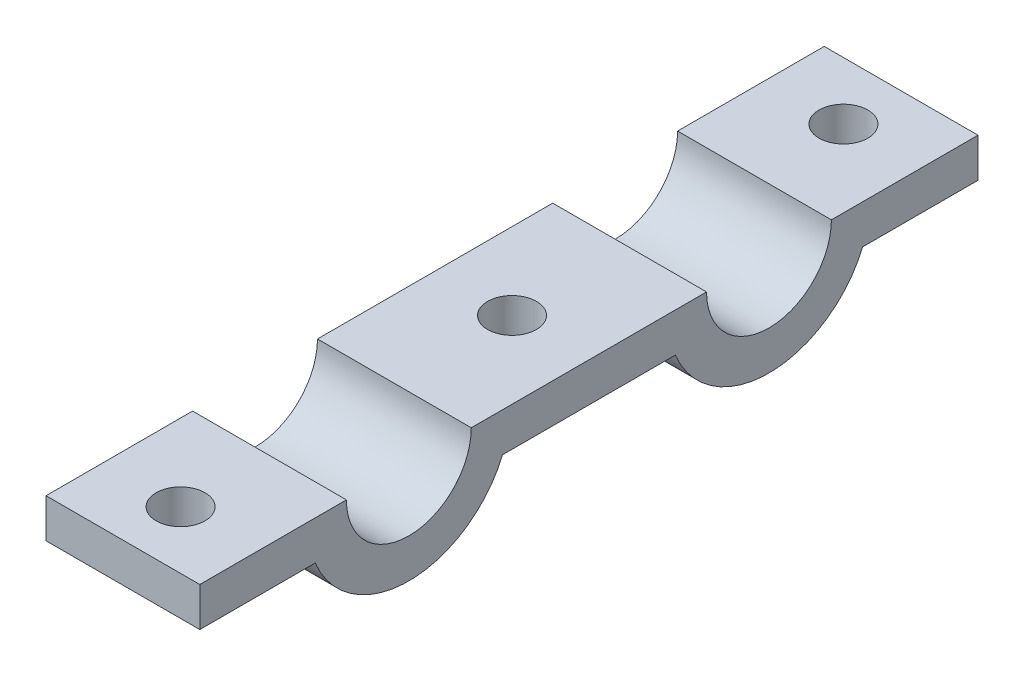
from build123d import *

# Parameters (mm, degrees)
BOSS_EXTRUDE1_DEPTH = 40
CUT_EXTRUDE1_REACH  = 157.594
SKETCH3_R           = 6.35


with BuildPart() as part:
    # Sketch2 → Boss-Extrude1 (new body)
    with BuildSketch(Plane(origin=(0, 0, 0), x_dir=(0, 0, -1), z_dir=(1, 0, 0))):
        with BuildLine():
            Line((-16.24, 0), (-54.366665755, 0))
            Line((-54.366665755, 0), (-54.366665755, -10.16))
            Line((-54.366665755, -10.16), (-24.366665755, -10.16))
            ThreePointArc((-24.366665755, -10.16), (0, -26.4), (24.366665755, -10.16))
            Line((24.366665755, -10.16), (69.295834245, -10.16))
            ThreePointArc((69.295834245, -10.16), (93.6625, -26.4), (118.029165755, -10.16))
            Line((118.029165755, -10.16), (148.029165755, -10.16))
            Line((148.029165755, -10.16), (148.029165755, 0))
            Line((148.029165755, 0), (109.9025, 0))
            ThreePointArc((109.9025, 0), (93.6625, -16.24), (77.4225, 0))
            Line((77.4225, 0), (16.24, 0))
            ThreePointArc((16.24, 0), (0, -16.24), (-16.24, 0))
        make_face()
    extrude(amount=BOSS_EXTRUDE1_DEPTH)

    # Sketch3 → Cut-Extrude1 (cut, up to next)
    with BuildSketch(Plane(origin=(0, 0, 0), x_dir=(1, 0, 0), z_dir=(0, 1, 0)), mode=Mode.PRIVATE) as cut_extrude1_sk1:
        with Locations((20, -39.366665755)):
            Circle(SKETCH3_R)
    cut_extrude1_tool1 = extrude(cut_extrude1_sk1.sketch, amount=-CUT_EXTRUDE1_REACH, mode=Mode.PRIVATE) & part.part
    # Sketch3 → Cut-Extrude1 (cut, up to next)
    with BuildSketch(Plane(origin=(0, 0, 0), x_dir=(1, 0, 0), z_dir=(0, 1, 0)), mode=Mode.PRIVATE) as cut_extrude1_sk2:
        with Locations((20, 133.029165755)):
            Circle(SKETCH3_R)
    cut_extrude1_tool2 = extrude(cut_extrude1_sk2.sketch, amount=-CUT_EXTRUDE1_REACH, mode=Mode.PRIVATE) & part.part
    # Sketch3 → Cut-Extrude1 (cut, up to next)
    with BuildSketch(Plane(origin=(0, 0, 0), x_dir=(1, 0, 0), z_dir=(0, 1, 0)), mode=Mode.PRIVATE) as cut_extrude1_sk3:
        with Locations((20, 46.83125)):
            Circle(SKETCH3_R)
    cut_extrude1_tool3 = extrude(cut_extrude1_sk3.sketch, amount=-CUT_EXTRUDE1_REACH, mode=Mode.PRIVATE) & part.part
    add(cut_extrude1_tool1.solids().sort_by_distance((20, 0, 39.366666))[0], mode=Mode.SUBTRACT)
    add(cut_extrude1_tool2.solids().sort_by_distance((20, 0, -133.029166))[0], mode=Mode.SUBTRACT)
    add(cut_extrude1_tool3.solids().sort_by_distance((20, 0, -46.83125))[0], mode=Mode.SUBTRACT)


solid = part.part
